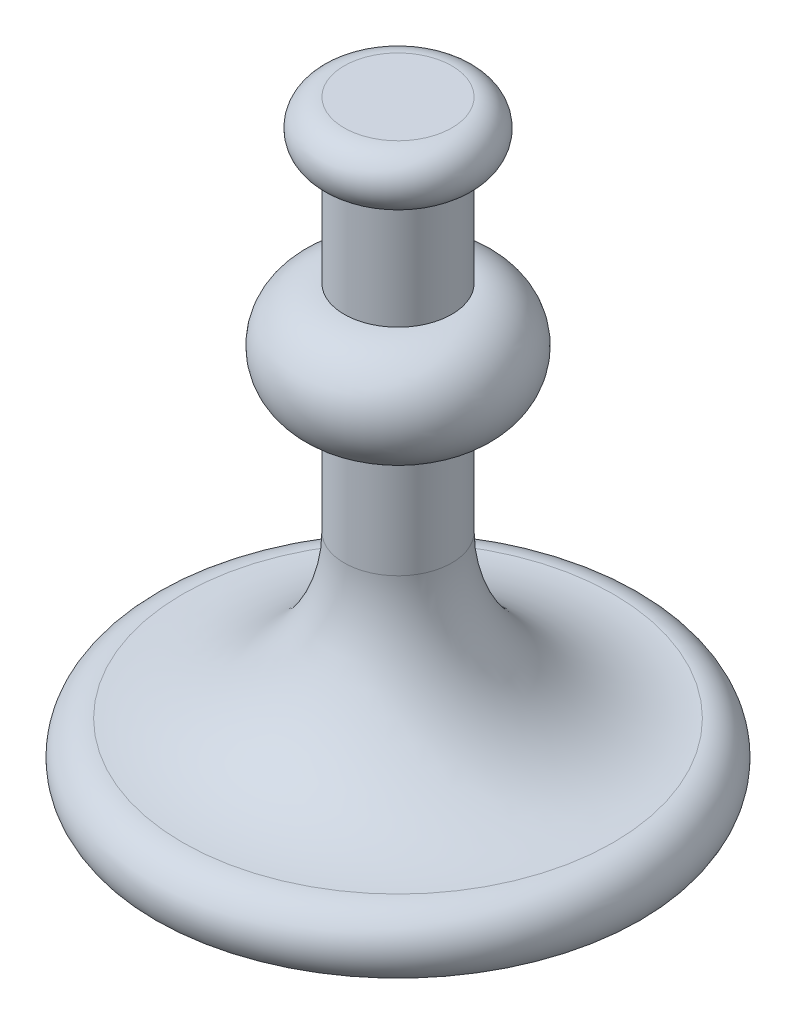
from build123d import *


with BuildPart() as part:
    # Sketch2 → Revolve1 (revolve)
    with BuildSketch(Plane.XY):
        with BuildLine():
            Line((0, 0), (0, 220))
            Line((0, 220), (20, 220))
            ThreePointArc((20, 220), (30, 210), (20, 200))
            Line((20, 200), (20, 160))
            ThreePointArc((20, 160), (40, 140), (20, 120))
            Line((20, 120), (20, 80))
            ThreePointArc((20, 80), (37.573593129, 37.573593129), (80, 20))
            ThreePointArc((80, 20), (91.180339887, 13.090169944), (90, 0))
            Line((90, 0), (0, 0))
        make_face()
    revolve(axis=Axis((0, 0, 0), (0, 1, 0)))


solid = part.part
